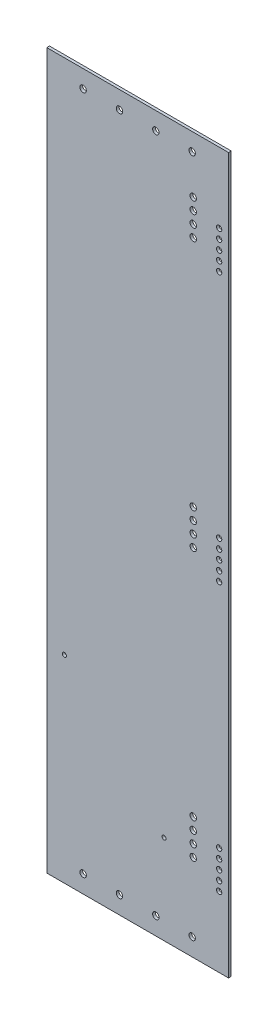
from build123d import *

# Parameters (mm, degrees)
SKETCH1_W                  = 155
SKETCH1_H                  = 609.6
BOSS_EXTRUDE1_DEPTH        = 2.305
M4_CLEARANCE_HOLE1_D       = 4.5
M5_CLEARANCE_HOLE1_D       = 5.5
F_3_5_3_5_DIAMETER_HOLE1_D = 3.5


with BuildPart() as part:
    # Sketch1 → Boss-Extrude1 (new body)
    with BuildSketch(Plane.XY):
        Rectangle(SKETCH1_W, SKETCH1_H)
    extrude(amount=BOSS_EXTRUDE1_DEPTH)

    # M4 Clearance Hole1 (through all)
    with Locations(Plane.XY.offset(2.305)):
        with Locations((69.5, 228.8), (69.5, 244.8), (69.5, 236.8), (69.5, 220.8), (69.5, 212.8), (69.5, 16), (69.5, 8), (69.5, 0), (69.5, -8), (69.5, -16), (69.5, -212.8), (69.5, -220.8), (69.5, -228.8), (69.5, -236.8), (69.5, -244.8)):
            Hole(M4_CLEARANCE_HOLE1_D / 2)

    # M5 Clearance Hole1 (through all)
    with Locations(Plane.XY.offset(2.305)):
        with Locations((-46.5, -289.795), (-15.5, -289.795), (15.5, -289.795), (46.5, -289.795), (-46.5, 289.795), (-15.5, 289.795), (15.5, 289.795), (46.5, 289.795), (47.4, -230.8), (47.4, -220.8), (47.4, -210.8), (47.4, -200.8), (47.4, -2), (47.4, 8), (47.4, 18), (47.4, 28), (47.4, 226.8), (47.4, 236.8), (47.4, 246.8), (47.4, 256.8)):
            Hole(M5_CLEARANCE_HOLE1_D / 2)

    # Ø3.5 (3.5) Diameter Hole1 (through all)
    with Locations(Plane(origin=(0, 0, 0), x_dir=(-1, 0, 0), z_dir=(0, 0, -1))):
        with Locations((-22.5, -228.6), (62.5, -136.1)):
            Hole(F_3_5_3_5_DIAMETER_HOLE1_D / 2)


solid = part.part
